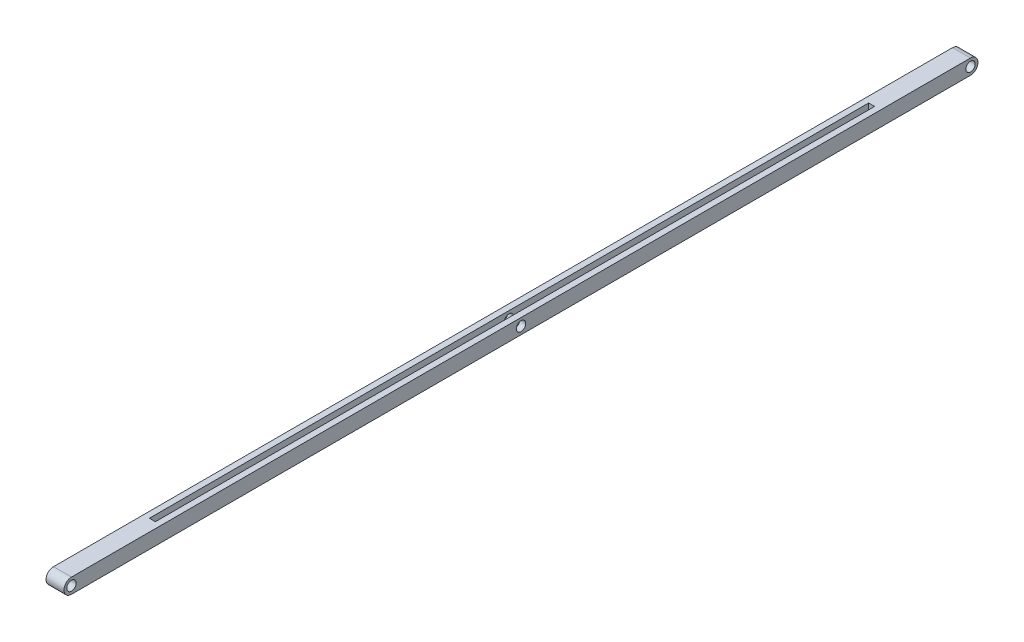
from build123d import *

# Parameters (mm, degrees)
BOSS_EXTRUDE1_DEPTH   = 15.24
F_8_0MM_DOWEL_HOLE1_D = 8
SKETCH5_W             = 5.08
SKETCH5_H             = 609.6
CUT_EXTRUDE1_DEPTH    = 692.164757493


with BuildPart() as part:
    # Sketch1 → Boss-Extrude1 (new body)
    with BuildSketch(Plane(origin=(0, 0, 0), x_dir=(0, 0, -1), z_dir=(1, 0, 0))):
        with BuildLine():
            Line((-77.47, 8.41375), (684.53, 8.41375))
            ThreePointArc((684.53, 8.41375), (690.88, 2.06375), (684.53, -4.28625))
            Line((684.53, -4.28625), (-77.47, -4.28625))
            ThreePointArc((-77.47, -4.28625), (-83.82, 2.06375), (-77.47, 8.41375))
        make_face()
    extrude(amount=BOSS_EXTRUDE1_DEPTH)

    # Ø8.0mm Dowel Hole1 (through all)
    with Locations(Plane(origin=(15.24, 0, 0), x_dir=(0, 0, -1), z_dir=(1, 0, 0))):
        with Locations((-77.47, 2.06375), (684.53, 2.06375), (303.53, 2.06375)):
            Hole(F_8_0MM_DOWEL_HOLE1_D / 2)

    # Sketch5 → Cut-Extrude1 (cut, through all)
    with BuildSketch(Plane(origin=(0, 8.41375, 0), x_dir=(1, 0, 0), z_dir=(0, 1, 0))):
        with Locations((7.62, 303.53)):
            Rectangle(SKETCH5_W, SKETCH5_H)
    extrude(amount=-CUT_EXTRUDE1_DEPTH, mode=Mode.SUBTRACT)


solid = part.part
